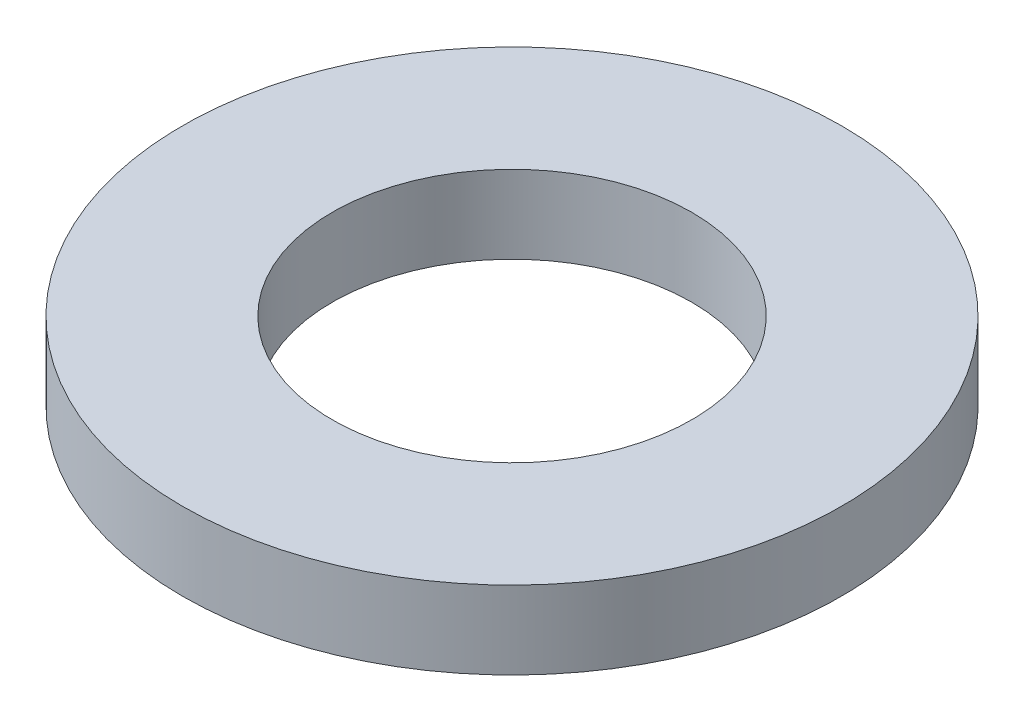
from build123d import *

# Parameters (mm, degrees)
SKETCH1_R           = 55
BOSS_EXTRUDE1_DEPTH = 13
SKETCH2_R           = 30
CUT_EXTRUDE1_DEPTH  = 79.860636569


with BuildPart() as part:
    # Sketch1 → Boss-Extrude1 (new body)
    with BuildSketch(Plane(origin=(0, 0, 0), x_dir=(1, 0, 0), z_dir=(0, 1, 0))):
        Circle(SKETCH1_R)
    extrude(amount=BOSS_EXTRUDE1_DEPTH)

    # Sketch2 → Cut-Extrude1 (cut, through all)
    with BuildSketch(Plane(origin=(0, 0, 0), x_dir=(1, 0, 0), z_dir=(0, 1, 0))):
        Circle(SKETCH2_R)
    extrude(amount=CUT_EXTRUDE1_DEPTH, mode=Mode.SUBTRACT)


solid = part.part
